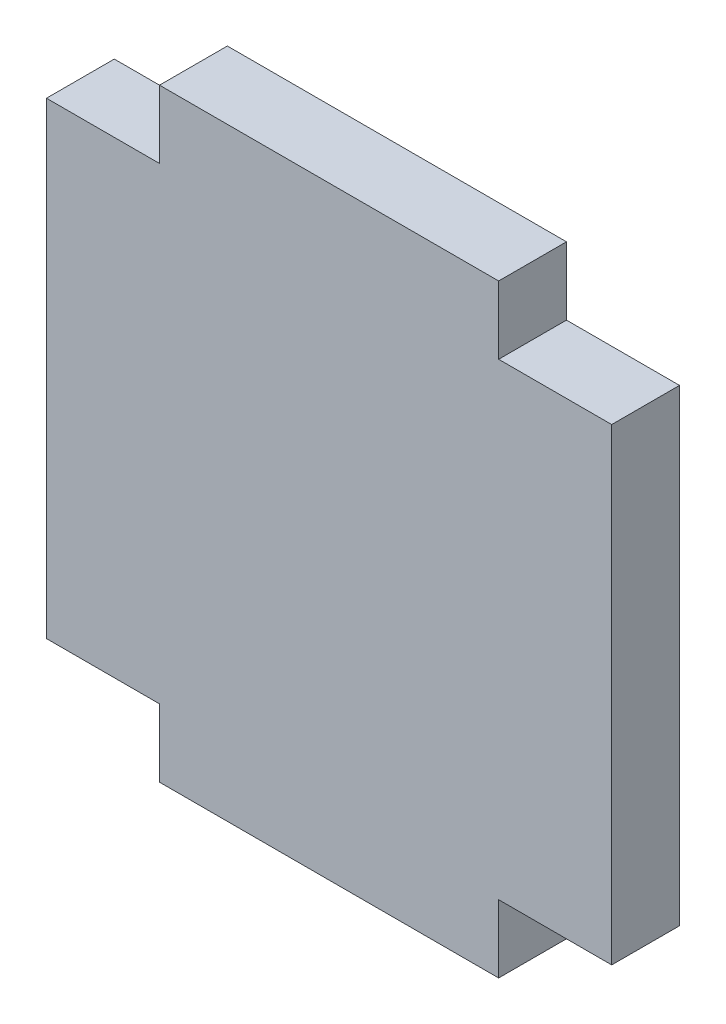
from build123d import *

# Parameters (mm, degrees)
RESSALTO_EXTRUS_O1_DEPTH = 3


with BuildPart() as part:
    # Esboço1 → Ressalto-extrusão1 (new body)
    with BuildSketch(Plane.XY):
        Polygon((-12.5, 10.35), (-12.5, -10.35), (-7.5, -10.35), (-7.5, -13.35), (7.5, -13.35), (7.5, -10.35), (12.5, -10.35), (12.5, 10.35), (7.5, 10.35), (7.5, 13.35), (-7.5, 13.35), (-7.5, 10.35), align=None)
    extrude(amount=RESSALTO_EXTRUS_O1_DEPTH)


solid = part.part
